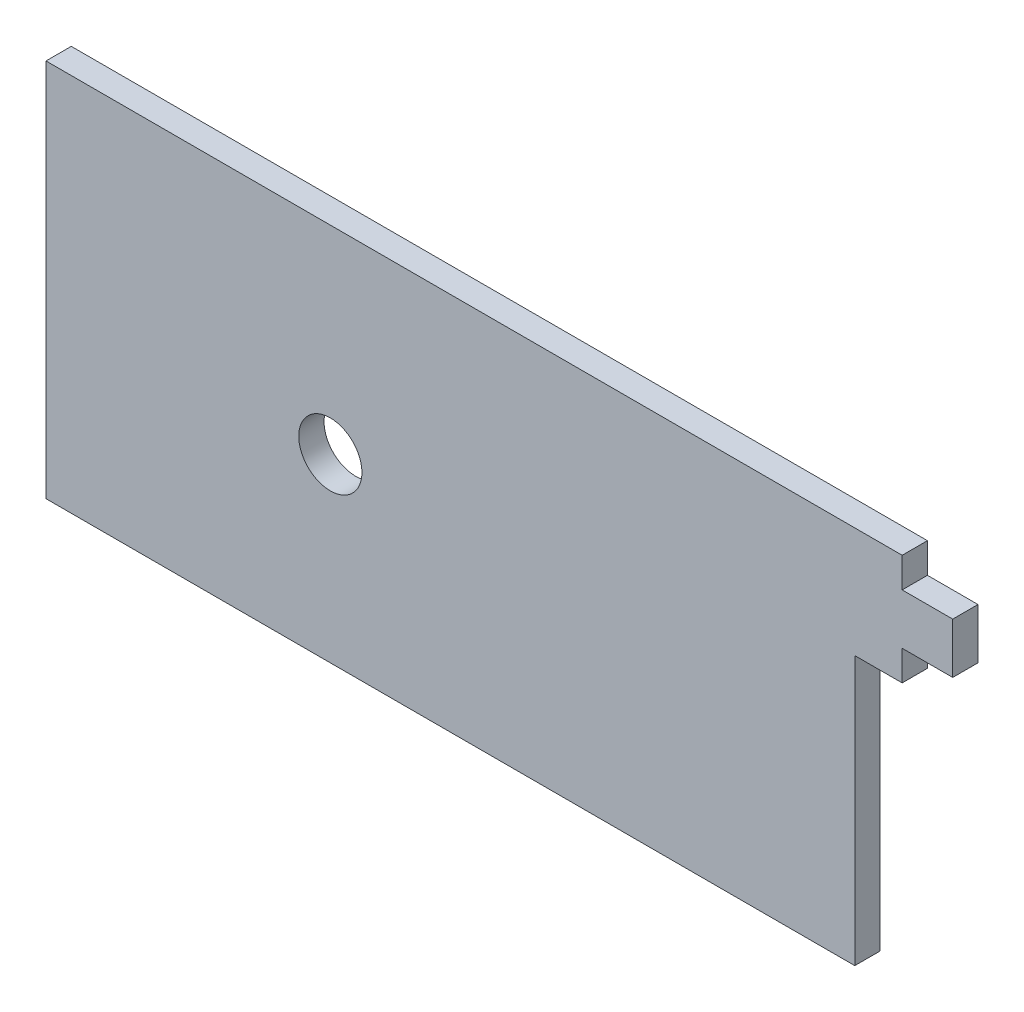
from build123d import *

# Parameters (mm, degrees)
SKETCH1_R           = 5
BOSS_EXTRUDE1_DEPTH = 4


with BuildPart() as part:
    # Sketch1 → Boss-Extrude1 (new body)
    with BuildSketch(Plane.XY):
        Polygon((47, 31.425927837), (54.5, 31.425927837), (54.5, 26.675927837), (62.5, 26.675927837), (62.5, 18.675927837), (54.5, 18.675927837), (54.5, 13.925927837), (47, 13.925927837), (47, -28.574072163), (-81, -28.574072163), (-81, 31.425927837), align=None)
        with Locations((-36, 0)):
            Circle(SKETCH1_R, mode=Mode.SUBTRACT)
    extrude(amount=BOSS_EXTRUDE1_DEPTH)


solid = part.part
